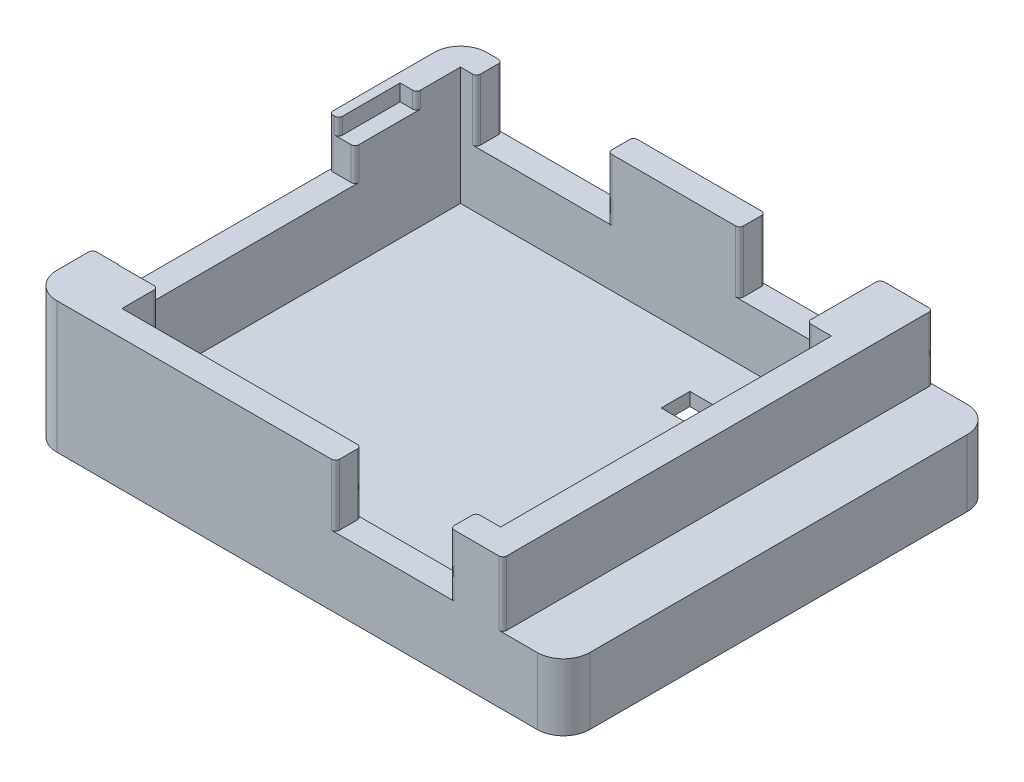
from build123d import *

# Parameters (mm, degrees)
SKETCH1_W           = 103.124
SKETCH1_H           = 83.185
BOSS_EXTRUDE1_DEPTH = 25.4
CUT_EXTRUDE1_DEPTH  = 22.86
SKETCH3_W           = 11.7475
SKETCH3_H           = 83.185
CUT_EXTRUDE2_DEPTH  = 12.4841
SKETCH4_W           = 22.225
SKETCH4_H           = 11.90625
CUT_EXTRUDE3_DEPTH  = 127
SKETCH5_W           = 25.4
SKETCH5_H           = 11.90625
CUT_EXTRUDE4_DEPTH  = 5.08
SKETCH6_W           = 45.7835
SKETCH6_H           = 9.525
CUT_EXTRUDE5_DEPTH  = 5.08
SKETCH7_W           = 3.175
SKETCH7_H           = 11.90625
CUT_EXTRUDE6_DEPTH  = 3.175
SKETCH8_W           = 11.1125
SKETCH8_H           = 5.55625
CUT_EXTRUDE7_DEPTH  = 5.08
FILLET1_R           = 5.08
FILLET2_R           = 0.762


with BuildPart() as part:
    # Sketch1 → Boss-Extrude1 (new body)
    with BuildSketch(Plane(origin=(0, 0, 0), x_dir=(1, 0, 0), z_dir=(0, 1, 0))):
        with Locations((51.562, 41.5925)):
            Rectangle(SKETCH1_W, SKETCH1_H)
    extrude(amount=BOSS_EXTRUDE1_DEPTH)

    # Sketch2 → Cut-Extrude1 (cut)
    with BuildSketch(Plane(origin=(0, 25.4, 0), x_dir=(1, 0, 0), z_dir=(0, 1, 0))):
        Polygon((4.9911, 78.1939), (81.1911, 78.1939), (81.1911, 69.0118), (85.9536, 69.0118), (85.9536, 4.9911), (12.7, 4.9911), (12.7, 11.9253), (4.9911, 11.9253), align=None)
    extrude(amount=-CUT_EXTRUDE1_DEPTH, mode=Mode.SUBTRACT)

    # Sketch3 → Cut-Extrude2 (cut)
    with BuildSketch(Plane(origin=(0, 25.4, 0), x_dir=(1, 0, 0), z_dir=(0, 1, 0))):
        with Locations((97.25025, 41.5925)):
            Rectangle(SKETCH3_W, SKETCH3_H)
    extrude(amount=-CUT_EXTRUDE2_DEPTH, mode=Mode.SUBTRACT)

    # Sketch4 → Cut-Extrude3 (cut)
    with BuildSketch(Plane(origin=(0, 0, -83.185), x_dir=(-1, 0, 0), z_dir=(0, 0, -1))):
        with Locations((-70.104, 19.446875)):
            Rectangle(SKETCH4_W, SKETCH4_H)
    extrude(amount=-CUT_EXTRUDE3_DEPTH, mode=Mode.SUBTRACT)

    # Sketch5 → Cut-Extrude4 (cut)
    with BuildSketch(Plane(origin=(0, 0, -83.185), x_dir=(-1, 0, 0), z_dir=(0, 0, -1))):
        with Locations((-20.8026, 19.446875)):
            Rectangle(SKETCH5_W, SKETCH5_H)
    extrude(amount=-CUT_EXTRUDE4_DEPTH, mode=Mode.SUBTRACT)

    # Sketch6 → Cut-Extrude5 (cut)
    with BuildSketch(Plane.ZY):
        with Locations((-34.89325, 20.6375)):
            Rectangle(SKETCH6_W, SKETCH6_H)
    extrude(amount=-CUT_EXTRUDE5_DEPTH, mode=Mode.SUBTRACT)

    # Sketch7 → Cut-Extrude6 (cut)
    with BuildSketch(Plane(origin=(0, 25.4, 0), x_dir=(1, 0, 0), z_dir=(0, 1, 0))):
        with Locations((3.4036, 63.738125)):
            Rectangle(SKETCH7_W, SKETCH7_H)
    extrude(amount=-CUT_EXTRUDE6_DEPTH, mode=Mode.SUBTRACT)

    # Sketch8 → Cut-Extrude7 (cut)
    with BuildSketch(Plane.XZ):
        with Locations((64.23025, -66.119375)):
            Rectangle(SKETCH8_W, SKETCH8_H)
    extrude(amount=-CUT_EXTRUDE7_DEPTH, mode=Mode.SUBTRACT)

    # Fillet1
    fillet1_edges = [part.edges().sort_by_distance(p)[0] for p in [
        (103.124, 6.45795, -83.185),
        (103.124, 6.45795, 0),
        (0, 12.7, 0),
        (0, 12.7, -83.185),
    ]]
    fillet(fillet1_edges, radius=FILLET1_R)

    # Fillet2
    fillet2_edges = [part.edges().sort_by_distance(p)[0] for p in [
        (91.3765, 19.15795, 0),
        (81.2165, 19.446875, 0),
        (81.2165, 19.446875, -4.9911),
        (58.9915, 19.446875, 0),
        (58.9915, 19.446875, -4.9911),
        (12.7, 13.97, -11.9253),
        (0, 20.6375, -12.0015),
        (0, 20.6375, -57.785),
        (91.3765, 19.15795, -83.185),
        (81.2165, 19.446875, -69.0118),
        (81.2165, 19.446875, -83.185),
        (58.9915, 19.446875, -83.185),
        (58.9915, 19.446875, -78.1939),
        (33.5026, 19.446875, -78.1939),
        (33.5026, 19.446875, -83.185),
        (8.1026, 19.446875, -83.185),
        (8.1026, 19.446875, -78.1939),
        (1.8161, 23.8125, -57.785),
        (4.9911, 23.8125, -69.69125),
        (4.9911, 19.05, -57.785),
    ]]
    fillet(fillet2_edges, radius=FILLET2_R)


solid = part.part
